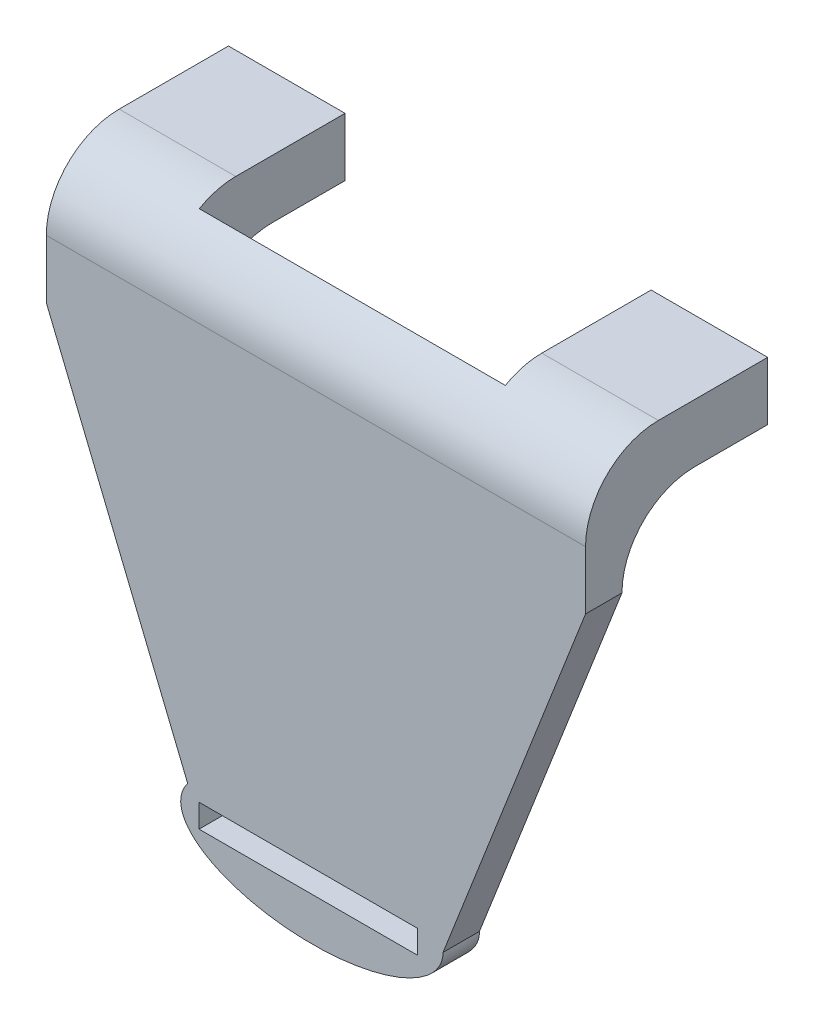
from build123d import *

# Parameters (mm, degrees)
PLATE_FEATURE_DEPTH        = 5
STRAP_FEATURE_SKETCH_RX    = 18
STRAP_FEATURE_SKETCH_RY    = 8
STRAP_FEATURE_DEPTH        = 5
STRAP_CUT_SKETCH_W         = 30
STRAP_CUT_SKETCH_H         = 3.19824666
STRAP_CUT_DEPTH            = 5
LEFT_LEG_FEATURE_SKETCH_W  = 16
LEFT_LEG_FEATURE_SKETCH_H  = 8
LEFT_LEG_FEATURE_DEPTH     = 20
RIGHT_LEG_FEATURE_SKETCH_W = 16
RIGHT_LEG_FEATURE_SKETCH_H = 8
RIGHT_LEG_FEATURE_DEPTH    = 20
TAB_CUT_SKETCH_W           = 8
TAB_CUT_SKETCH_H           = 15
TAB_CUT_DEPTH              = 5
FILLET1_R                  = 10
FILLET2_R                  = 10
FILLET3_R                  = 10


with BuildPart() as part:
    # Plate Feature Sketch → Plate Feature (new body)
    with BuildSketch(Plane.XY):
        Polygon((-36, 18), (-36, 0), (-15.55368079, -50), (18.44631921, -50), (38, 0), (38, 18), align=None)
    extrude(amount=PLATE_FEATURE_DEPTH)

    # Strap Feature Sketch → Strap Feature (add)
    with BuildSketch(Plane.XY):
        with Locations((0.44631921, -50)):
            Ellipse(STRAP_FEATURE_SKETCH_RX, STRAP_FEATURE_SKETCH_RY)
    extrude(amount=STRAP_FEATURE_DEPTH)

    # Strap Cut Sketch → Strap Cut (cut)
    with BuildSketch(Plane.XY):
        with Locations((-0.034918838, -50.490814337)):
            Rectangle(STRAP_CUT_SKETCH_W, STRAP_CUT_SKETCH_H)
    extrude(amount=STRAP_CUT_DEPTH, mode=Mode.SUBTRACT)

    # Left Leg Feature Sketch → Left Leg Feature (add)
    with BuildSketch(Plane.XY):
        with Locations((30, 14)):
            Rectangle(LEFT_LEG_FEATURE_SKETCH_W, LEFT_LEG_FEATURE_SKETCH_H)
    extrude(amount=-LEFT_LEG_FEATURE_DEPTH)

    # Right Leg Feature Sketch → Right Leg Feature (add)
    with BuildSketch(Plane.XY):
        with Locations((-28, 14)):
            Rectangle(RIGHT_LEG_FEATURE_SKETCH_W, RIGHT_LEG_FEATURE_SKETCH_H)
    extrude(amount=-RIGHT_LEG_FEATURE_DEPTH)

    # Tab Cut Sketch → Tab Cut (cut)
    with BuildSketch(Plane(origin=(0, 10, 0), x_dir=(1, 0, 0), z_dir=(0, 1, 0))):
        with Locations((-28, 12.5)):
            Rectangle(TAB_CUT_SKETCH_W, TAB_CUT_SKETCH_H)
        with Locations((30, 12.5)):
            Rectangle(TAB_CUT_SKETCH_W, TAB_CUT_SKETCH_H)
    extrude(amount=TAB_CUT_DEPTH, mode=Mode.SUBTRACT)

    # Fillet1
    # the kernel refuses this fillet: 10 mm, written as the material it takes off along each edge
    with BuildSketch(Plane(origin=(63, 18, 5), x_dir=(0, 0, -1), z_dir=(-1, 0, 0))) as fillet1_piece_1:
        with BuildLine():
            CenterArc((FILLET1_R, FILLET1_R), FILLET1_R, 180, 90)
            Line((0, FILLET1_R), (0, 0))
            Line((0, 0), (FILLET1_R, 0))
        make_face()
    extrude(amount=124, mode=Mode.SUBTRACT)

    # Fillet2
    # the kernel refuses this fillet: 10 mm, written as the material it adds along each edge
    with BuildSketch(Plane(origin=(-36, 10, 0), x_dir=(0, 0, -1), z_dir=(1, 0, 0))) as fillet2_piece_1_section:
        with BuildLine():
            CenterArc((FILLET2_R, -FILLET2_R), FILLET2_R, 90, 90)
            Line((0, -FILLET2_R), (0, 0))
            Line((0, 0), (FILLET2_R, 0))
        make_face()
    fillet2_piece_1 = extrude(amount=16, mode=Mode.PRIVATE)
    fillet2_piece_1 = split(fillet2_piece_1, bisect_by=Plane(origin=(-34, 9.759916183, -5), z_dir=(0, 0, -1)), keep=Keep.TOP, mode=Mode.PRIVATE)
    fillet2_piece_1 = split(fillet2_piece_1, bisect_by=Plane(origin=(-32, 9.759916183, -6.632507845), z_dir=(-1, 0, 0)), keep=Keep.TOP, mode=Mode.PRIVATE)
    add(fillet2_piece_1)
    with BuildSketch(Plane(origin=(-36, 10, 0), x_dir=(0, 0, -1), z_dir=(1, 0, 0))) as fillet2_piece_2_section:
        with BuildLine():
            CenterArc((FILLET2_R, -FILLET2_R), FILLET2_R, 90, 90)
            Line((0, -FILLET2_R), (0, 0))
            Line((0, 0), (FILLET2_R, 0))
        make_face()
    fillet2_piece_2 = extrude(amount=16, mode=Mode.PRIVATE)
    fillet2_piece_2 = split(fillet2_piece_2, bisect_by=Plane(origin=(-34, 7.4487994, -5), z_dir=(0, 0, 1)), keep=Keep.TOP, mode=Mode.PRIVATE)
    fillet2_piece_2 = split(fillet2_piece_2, bisect_by=Plane(origin=(-32, 7.4487994, -1.643917643), z_dir=(-1, 0, 0)), keep=Keep.TOP, mode=Mode.PRIVATE)
    add(fillet2_piece_2)
    with BuildSketch(Plane(origin=(-36, 10, 0), x_dir=(0, 0, -1), z_dir=(1, 0, 0))) as fillet2_piece_3_section:
        with BuildLine():
            CenterArc((FILLET2_R, -FILLET2_R), FILLET2_R, 90, 90)
            Line((0, -FILLET2_R), (0, 0))
            Line((0, 0), (FILLET2_R, 0))
        make_face()
    fillet2_piece_3 = extrude(amount=16, mode=Mode.PRIVATE)
    fillet2_piece_3 = split(fillet2_piece_3, bisect_by=Plane(origin=(-24, 7.4487994, -1.643917643), z_dir=(-1, 0, 0)), keep=Keep.TOP, mode=Mode.PRIVATE)
    fillet2_piece_3 = split(fillet2_piece_3, bisect_by=Plane(origin=(-28, 7.4487994, -5), z_dir=(0, 0, 1)), keep=Keep.TOP, mode=Mode.PRIVATE)
    fillet2_piece_3 = split(fillet2_piece_3, bisect_by=Plane(origin=(-32, 7.4487994, -1.643917643), z_dir=(1, 0, 0)), keep=Keep.TOP, mode=Mode.PRIVATE)
    add(fillet2_piece_3)
    with BuildSketch(Plane(origin=(-36, 10, 0), x_dir=(0, 0, -1), z_dir=(1, 0, 0))) as fillet2_piece_4_section:
        with BuildLine():
            CenterArc((FILLET2_R, -FILLET2_R), FILLET2_R, 90, 90)
            Line((0, -FILLET2_R), (0, 0))
            Line((0, 0), (FILLET2_R, 0))
        make_face()
    fillet2_piece_4 = extrude(amount=16, mode=Mode.PRIVATE)
    fillet2_piece_4 = split(fillet2_piece_4, bisect_by=Plane(origin=(-24, 9.759916183, -6.632507845), z_dir=(1, 0, 0)), keep=Keep.TOP, mode=Mode.PRIVATE)
    fillet2_piece_4 = split(fillet2_piece_4, bisect_by=Plane(origin=(-22, 9.759916183, -5), z_dir=(0, 0, -1)), keep=Keep.TOP, mode=Mode.PRIVATE)
    add(fillet2_piece_4)
    with BuildSketch(Plane(origin=(-36, 10, 0), x_dir=(0, 0, -1), z_dir=(1, 0, 0))) as fillet2_piece_5_section:
        with BuildLine():
            CenterArc((FILLET2_R, -FILLET2_R), FILLET2_R, 90, 90)
            Line((0, -FILLET2_R), (0, 0))
            Line((0, 0), (FILLET2_R, 0))
        make_face()
    fillet2_piece_5 = extrude(amount=16, mode=Mode.PRIVATE)
    fillet2_piece_5 = split(fillet2_piece_5, bisect_by=Plane(origin=(-24, 7.4487994, -1.643917643), z_dir=(1, 0, 0)), keep=Keep.TOP, mode=Mode.PRIVATE)
    fillet2_piece_5 = split(fillet2_piece_5, bisect_by=Plane(origin=(-22, 7.4487994, -5), z_dir=(0, 0, 1)), keep=Keep.TOP, mode=Mode.PRIVATE)
    add(fillet2_piece_5)

    # Fillet3
    # the kernel refuses this fillet: 10 mm, written as the material it adds along each edge
    with BuildSketch(Plane(origin=(38, 10, 0), x_dir=(0, 0, -1), z_dir=(-1, 0, 0))) as fillet3_piece_1_section:
        with BuildLine():
            CenterArc((FILLET3_R, FILLET3_R), FILLET3_R, 180, 90)
            Line((0, FILLET3_R), (0, 0))
            Line((0, 0), (FILLET3_R, 0))
        make_face()
    fillet3_piece_1 = extrude(amount=16, mode=Mode.PRIVATE)
    fillet3_piece_1 = split(fillet3_piece_1, bisect_by=Plane(origin=(36, 9.759916183, -5), z_dir=(0, 0, -1)), keep=Keep.TOP, mode=Mode.PRIVATE)
    fillet3_piece_1 = split(fillet3_piece_1, bisect_by=Plane(origin=(34, 9.759916183, -6.632507845), z_dir=(1, 0, 0)), keep=Keep.TOP, mode=Mode.PRIVATE)
    add(fillet3_piece_1)
    with BuildSketch(Plane(origin=(38, 10, 0), x_dir=(0, 0, -1), z_dir=(-1, 0, 0))) as fillet3_piece_2_section:
        with BuildLine():
            CenterArc((FILLET3_R, FILLET3_R), FILLET3_R, 180, 90)
            Line((0, FILLET3_R), (0, 0))
            Line((0, 0), (FILLET3_R, 0))
        make_face()
    fillet3_piece_2 = extrude(amount=16, mode=Mode.PRIVATE)
    fillet3_piece_2 = split(fillet3_piece_2, bisect_by=Plane(origin=(36, 7.4487994, -5), z_dir=(0, 0, 1)), keep=Keep.TOP, mode=Mode.PRIVATE)
    fillet3_piece_2 = split(fillet3_piece_2, bisect_by=Plane(origin=(34, 7.4487994, -1.643917643), z_dir=(1, 0, 0)), keep=Keep.TOP, mode=Mode.PRIVATE)
    add(fillet3_piece_2)
    with BuildSketch(Plane(origin=(38, 10, 0), x_dir=(0, 0, -1), z_dir=(-1, 0, 0))) as fillet3_piece_3_section:
        with BuildLine():
            CenterArc((FILLET3_R, FILLET3_R), FILLET3_R, 180, 90)
            Line((0, FILLET3_R), (0, 0))
            Line((0, 0), (FILLET3_R, 0))
        make_face()
    fillet3_piece_3 = extrude(amount=16, mode=Mode.PRIVATE)
    fillet3_piece_3 = split(fillet3_piece_3, bisect_by=Plane(origin=(26, 7.4487994, -1.643917643), z_dir=(1, 0, 0)), keep=Keep.TOP, mode=Mode.PRIVATE)
    fillet3_piece_3 = split(fillet3_piece_3, bisect_by=Plane(origin=(30, 7.4487994, -5), z_dir=(0, 0, 1)), keep=Keep.TOP, mode=Mode.PRIVATE)
    fillet3_piece_3 = split(fillet3_piece_3, bisect_by=Plane(origin=(34, 7.4487994, -1.643917643), z_dir=(-1, 0, 0)), keep=Keep.TOP, mode=Mode.PRIVATE)
    add(fillet3_piece_3)
    with BuildSketch(Plane(origin=(38, 10, 0), x_dir=(0, 0, -1), z_dir=(-1, 0, 0))) as fillet3_piece_4_section:
        with BuildLine():
            CenterArc((FILLET3_R, FILLET3_R), FILLET3_R, 180, 90)
            Line((0, FILLET3_R), (0, 0))
            Line((0, 0), (FILLET3_R, 0))
        make_face()
    fillet3_piece_4 = extrude(amount=16, mode=Mode.PRIVATE)
    fillet3_piece_4 = split(fillet3_piece_4, bisect_by=Plane(origin=(26, 9.759916183, -6.632507845), z_dir=(-1, 0, 0)), keep=Keep.TOP, mode=Mode.PRIVATE)
    fillet3_piece_4 = split(fillet3_piece_4, bisect_by=Plane(origin=(24, 9.759916183, -5), z_dir=(0, 0, -1)), keep=Keep.TOP, mode=Mode.PRIVATE)
    add(fillet3_piece_4)
    with BuildSketch(Plane(origin=(38, 10, 0), x_dir=(0, 0, -1), z_dir=(-1, 0, 0))) as fillet3_piece_5_section:
        with BuildLine():
            CenterArc((FILLET3_R, FILLET3_R), FILLET3_R, 180, 90)
            Line((0, FILLET3_R), (0, 0))
            Line((0, 0), (FILLET3_R, 0))
        make_face()
    fillet3_piece_5 = extrude(amount=16, mode=Mode.PRIVATE)
    fillet3_piece_5 = split(fillet3_piece_5, bisect_by=Plane(origin=(26, 7.4487994, -1.643917643), z_dir=(-1, 0, 0)), keep=Keep.TOP, mode=Mode.PRIVATE)
    fillet3_piece_5 = split(fillet3_piece_5, bisect_by=Plane(origin=(24, 7.4487994, -5), z_dir=(0, 0, 1)), keep=Keep.TOP, mode=Mode.PRIVATE)
    add(fillet3_piece_5)


solid = part.part
